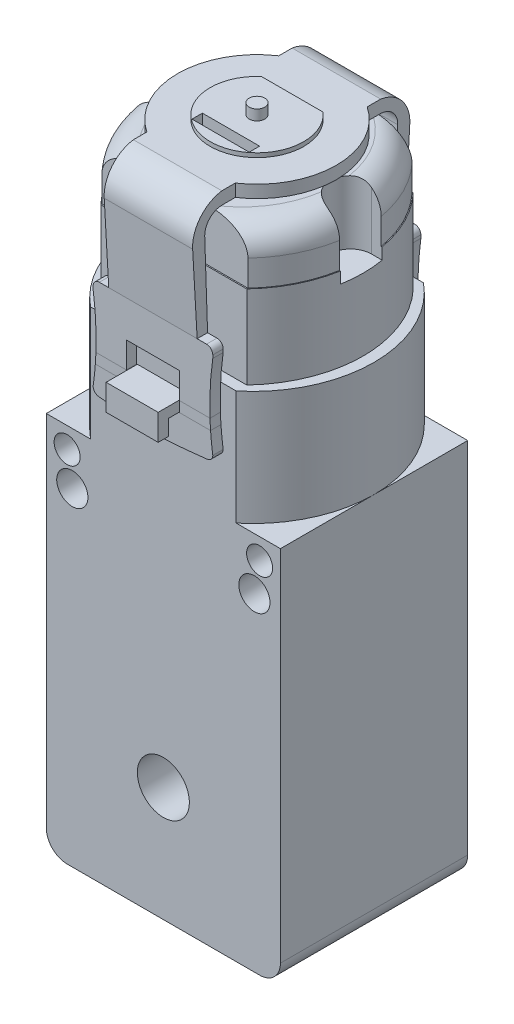
from build123d import *

# Parameters (mm, degrees)
SALIENTE_EXTRUIR1_DEPTH         = 9
SALIENTE_EXTRUIR1_DEPTH_BACK    = 9
CROQUIS1_R                      = 1.5
CROQUIS1_R_2                    = 1.25
SALIENTE_EXTRUIR2_DEPTH         = 11
SALIENTE_EXTRUIR3_DEPTH         = 1.5
SALIENTE_EXTRUIR3_DEPTH_BACK    = 1.5
CROQUIS3_W                      = 5
CROQUIS3_H                      = 5
CROQUIS3_R                      = 1.25
REDONDEO1_R                     = 0.3
CORTAR_EXTRUIR1_DEPTH           = 10
CORTAR_EXTRUIR1_DEPTH_BACK      = 10
CROQUIS4_R                      = 2.5
CROQUIS5_R                      = 0.75
CROQUIS5_R_2                    = 1
CORTAR_EXTRUIR2_DEPTH           = 1.5
CROQUIS6_R                      = 2
SALIENTE_EXTRUIR4_DEPTH         = 2
CROQUIS7_R                      = 3.5
CROQUIS7_R_2                    = 2.5
SALIENTE_EXTRUIR5_DEPTH         = 0.2
CORTAR_EXTRUIR5_DEPTH           = 10
CORTAR_EXTRUIR6_DEPTH           = 10
CORTAR_EXTRUIR6_DEPTH_BACK      = 10
CROQUIS9_W                      = 6
CROQUIS9_H                      = 3
SALIENTE_EXTRUIR6_DEPTH         = 2.5
SALIENTE_EXTRUIR7_DEPTH         = 18
SALIENTE_EXTRUIR8_DEPTH         = 5
REDONDEO2_R                     = 2.5
CROQUIS14_W                     = 5.5
CROQUIS14_H                     = 1
SALIENTE_EXTRUIR9_DEPTH         = 2
CROQUIS15_R                     = 0.75
SALIENTE_EXTRUIR10_DEPTH        = 1
CROQUIS16_R                     = 2.25
CORTAR_EXTRUIR7_DEPTH           = 2
SALIENTE_EXTRUIR11_DEPTH        = 1.8
CORTAR_EXTRUIR8_DEPTH           = 0.5
CROQUIS20_R                     = 7.630674975
CROQUIS20_R_2                   = 4.5
SALIENTE_EXTRUIR13_DEPTH        = 1.2
SALIENTE_EXTRUIR12_DEPTH        = 5.75
SALIENTE_EXTRUIR12_DEPTH_BACK   = 5.75
SALIENTE_EXTRUIR12_2_DEPTH      = 5.75
SALIENTE_EXTRUIR12_2_DEPTH_BACK = 5.75
CROQUIS19_W                     = 1
CROQUIS19_H                     = 3
SALIENTE_EXTRUIR12_3_DEPTH      = 5.75
SALIENTE_EXTRUIR12_3_DEPTH_BACK = 5.75
SALIENTE_EXTRUIR12_4_DEPTH      = 5.75
SALIENTE_EXTRUIR12_4_DEPTH_BACK = 5.75
CORTAR_EXTRUIR9_DEPTH           = 1
CORTAR_EXTRUIR9_DEPTH_BACK      = 1.8
CROQUIS23_W                     = 1.5
CROQUIS23_H                     = 11.127845587
CORTAR_EXTRUIR10_DEPTH          = 1.8
CORTAR_EXTRUIR10_DEPTH_BACK     = 1.8
CROQUIS24_W                     = 1.5
CROQUIS24_H                     = 11.127845587
CROQUIS21_W                     = 3.192032896
CROQUIS21_H                     = 1
SALIENTE_EXTRUIR17_DEPTH        = 1
SALIENTE_EXTRUIR17_2_DEPTH      = 1
CROQUIS26_W                     = 3.19
CROQUIS26_H                     = 1
SALIENTE_EXTRUIR18_DEPTH        = 1
SALIENTE_EXTRUIR18_2_DEPTH      = 1
CORTAR_EXTRUIR13_DEPTH          = 1
CORTAR_EXTRUIR14_DEPTH          = 1
CROQUIS29_W                     = 5.115934208
CROQUIS29_H                     = 2.5
CORTAR_EXTRUIR15_DEPTH          = 1
CROQUIS30_W                     = 5.12
CROQUIS30_H                     = 2.5
CORTAR_EXTRUIR16_DEPTH          = 1
CORTAR_EXTRUIR17_DEPTH          = 1
CORTAR_EXTRUIR18_DEPTH          = 1
CORTAR_EXTRUIR19_DEPTH          = 1.5
CORTAR_EXTRUIR19_DEPTH_BACK     = 0.3
CROQUIS33_W                     = 1.5
CROQUIS33_H                     = 0.569325025
SALIENTE_EXTRUIR19_DEPTH        = 1.2
REDONDEO3_R                     = 0.6
REDONDEO4_R                     = 0.6
REDONDEO5_R                     = 0.6
REDONDEO6_R                     = 0.6
CORTAR_EXTRUIR20_DEPTH          = 6.5


with BuildPart() as part:
    # Croquis1 → Saliente-Extruir1 (new, two sides: drawn at the far end of the back side and taken through both)
    # profile 1 of 2: a face of its own
    with BuildSketch(Plane.XY.offset(-SALIENTE_EXTRUIR1_DEPTH_BACK)):
        with BuildLine():
            Line((0, -19.25), (0, 17.25))
            Line((0, 17.25), (-11.25, 17.25))
            Line((-11.25, 17.25), (-11.25, -17.25))
            ThreePointArc((-11.25, -17.25), (-10.664213562, -18.664213562), (-9.25, -19.25))
            Line((-9.25, -19.25), (0, -19.25))
        make_face()
        with Locations((-8.75, 12.25)):
            Circle(CROQUIS1_R, mode=Mode.SUBTRACT)
        with Locations((-9.25, 15.25)):
            Circle(CROQUIS1_R_2, mode=Mode.SUBTRACT)
    # profile 2 of 2: a face of its own
    with BuildSketch(Plane.XY.offset(-SALIENTE_EXTRUIR1_DEPTH_BACK)):
        with BuildLine():
            Line((11.25, 17.25), (0, 17.25))
            Line((0, 17.25), (0, -19.25))
            Line((0, -19.25), (9.25, -19.25))
            ThreePointArc((9.25, -19.25), (10.664213562, -18.664213562), (11.25, -17.25))
            Line((11.25, -17.25), (11.25, 17.25))
        make_face()
        with Locations((8.75, 12.25)):
            Circle(CROQUIS1_R, mode=Mode.SUBTRACT)
        with Locations((9.25, 15.25)):
            Circle(CROQUIS1_R_2, mode=Mode.SUBTRACT)
    extrude(amount=SALIENTE_EXTRUIR1_DEPTH + SALIENTE_EXTRUIR1_DEPTH_BACK)

    # Croquis2 → Saliente-Extruir2 (add)
    with BuildSketch(Plane(origin=(0, 17.25, 0), x_dir=(1, 0, 0), z_dir=(0, 1, 0))):
        with BuildLine():
            Line((-7, 9), (7, 9))
            ThreePointArc((7, 9), (11.25, 0), (7, -9))
            Line((7, -9), (-7, -9))
            ThreePointArc((-7, -9), (-11.25, 0), (-7, 9))
        make_face()
    extrude(amount=SALIENTE_EXTRUIR2_DEPTH)

    # Croquis3 → Saliente-Extruir3 (add, two sides: drawn at the far end of the back side and taken through both)
    with BuildSketch(Plane.XY.offset(-SALIENTE_EXTRUIR3_DEPTH_BACK)):
        with Locations((0, -21.75)):
            Rectangle(CROQUIS3_W, CROQUIS3_H)
        with Locations((0, -21.75)):
            Circle(CROQUIS3_R, mode=Mode.SUBTRACT)
    extrude(amount=SALIENTE_EXTRUIR3_DEPTH + SALIENTE_EXTRUIR3_DEPTH_BACK)

    # Redondeo1
    redondeo1_edges = [part.edges().sort_by_distance(p)[0] for p in [
        (-2.5, -19.25, 0),
        (2.5, -19.25, 0),
    ]]
    fillet(redondeo1_edges, radius=REDONDEO1_R)

    # Croquis4 → Cortar-Extruir1 (cut, two sides: drawn at the far end of the back side and taken through both)
    with BuildSketch(Plane.XY.offset(-CORTAR_EXTRUIR1_DEPTH_BACK)):
        with Locations((0, -8.25)):
            Circle(CROQUIS4_R)
    extrude(amount=CORTAR_EXTRUIR1_DEPTH + CORTAR_EXTRUIR1_DEPTH_BACK, mode=Mode.SUBTRACT)

    # Croquis5 → Cortar-Extruir2 (cut)
    with BuildSketch(Plane(origin=(0, 0, -9), x_dir=(-1, 0, 0), z_dir=(0, 0, -1))):
        with Locations((9.75, -2.25)):
            Circle(CROQUIS5_R)
        with Locations((9.25, -17.25)):
            Circle(CROQUIS5_R_2)
        with Locations(Location((-9.25, -17.25, 0), (0, 0, 180))):
            Circle(CROQUIS5_R_2)
        with Locations(Location((-9.75, -2.25, 0), (0, 0, 180))):
            Circle(CROQUIS5_R)
    extrude(amount=-CORTAR_EXTRUIR2_DEPTH, mode=Mode.SUBTRACT)

    # Croquis6 → Saliente-Extruir4 (add)
    with BuildSketch(Plane(origin=(0, 0, -9), x_dir=(-1, 0, 0), z_dir=(0, 0, -1))):
        with Locations((0, 2.75)):
            Circle(CROQUIS6_R)
    extrude(amount=SALIENTE_EXTRUIR4_DEPTH)

    # Croquis7 → Saliente-Extruir5 (add)
    with BuildSketch(Plane(origin=(0, 0, -9), x_dir=(-1, 0, 0), z_dir=(0, 0, -1))):
        with Locations(Location((0, -8.25, 0), (0, 0, 180))):
            Circle(CROQUIS7_R)
        with Locations((0, -8.25)):
            Circle(CROQUIS7_R_2, mode=Mode.SUBTRACT)
    extrude(amount=SALIENTE_EXTRUIR5_DEPTH)

    # Croquis8 → Cortar-Extruir5 (cut)
    with BuildSketch(Plane(origin=(0, 28.25, 0), x_dir=(1, 0, 0), z_dir=(0, 1, 0))):
        with BuildLine():
            Line((-7.016222591, -8), (7.016222591, -8))
            ThreePointArc((7.016222591, -8), (10.197308847, 0), (7.016222591, 8))
            Line((7.016222591, 8), (-7.016222591, 8))
            ThreePointArc((-7.016222591, 8), (-10.197308847, 0), (-7.016222591, -8))
        make_face()
    extrude(amount=-CORTAR_EXTRUIR5_DEPTH, mode=Mode.SUBTRACT)

    # Croquis9 → Cortar-Extruir6 (cut, two sides: drawn at the far end of the back side and taken through both)
    with BuildSketch(Plane.XY.offset(-CORTAR_EXTRUIR6_DEPTH_BACK)):
        with Locations((0.040682318, 23.222154413)):
            Rectangle(CROQUIS9_W, CROQUIS9_H)
    extrude(amount=CORTAR_EXTRUIR6_DEPTH + CORTAR_EXTRUIR6_DEPTH_BACK, mode=Mode.SUBTRACT)

    # Croquis11 → Saliente-Extruir6 (add, symmetric)
    with BuildSketch(Plane(origin=(0, 0, 0), x_dir=(0, 0, -1), z_dir=(1, 0, 0))):
        Polygon((-9, 24.722154413), (-11, 24.722154413), (-11, 23.222154413), (-12, 23.222154413), (-12, 25.722154413), (-9, 25.722154413), align=None)
    saliente_extruir6 = extrude(amount=SALIENTE_EXTRUIR6_DEPTH, both=True)

    # Simetría1: Saliente-Extruir6 across plane
    add(saliente_extruir6.mirror(Plane.XY))

    # Croquis16 → Cortar-Extruir7 (cut)
    with BuildSketch(Plane(origin=(0, 0, -9), x_dir=(-1, 0, 0), z_dir=(0, 0, -1))):
        with Locations((5.994074793, 14.65)):
            Circle(CROQUIS16_R)
        with Locations((-5.994074793, 14.65)):
            Circle(CROQUIS16_R)
    extrude(amount=-CORTAR_EXTRUIR7_DEPTH, mode=Mode.SUBTRACT)

    # Croquis17 → Saliente-Extruir11 (add)
    with BuildSketch(Plane(origin=(0, 0, -7), x_dir=(-1, 0, 0), z_dir=(0, 0, -1))):
        with BuildLine():
            Line((5.690841964, 14.95), (5.690841964, 16.373528315))
            ThreePointArc((5.690841964, 16.373528315), (4.755478128, 15.886275981), (4.269980828, 14.95))
            Line((4.269980828, 14.95), (5.690841964, 14.95))
        make_face()
        with BuildLine():
            ThreePointArc((7.718168758, 14.95), (7.232671458, 15.886275981), (6.297307623, 16.373528315))
            Line((6.297307623, 16.373528315), (6.297307623, 14.95))
            Line((6.297307623, 14.95), (7.718168758, 14.95))
        make_face()
        with BuildLine():
            ThreePointArc((6.297307623, 12.926471685), (7.232671458, 13.413724019), (7.718168758, 14.35))
            Line((7.718168758, 14.35), (6.297307623, 14.35))
            Line((6.297307623, 14.35), (6.297307623, 12.926471685))
        make_face()
        with BuildLine():
            Line((6.297307623, 14.95), (6.297307623, 16.373528315))
            ThreePointArc((6.297307623, 16.373528315), (5.994074793, 16.4), (5.690841964, 16.373528315))
            Line((5.690841964, 16.373528315), (5.690841964, 14.95))
            Line((5.690841964, 14.95), (4.269980828, 14.95))
            ThreePointArc((4.269980828, 14.95), (4.244074793, 14.65), (4.269980828, 14.35))
            Line((4.269980828, 14.35), (5.690841964, 14.35))
            Line((5.690841964, 14.35), (5.690841964, 12.926471685))
            ThreePointArc((5.690841964, 12.926471685), (5.994074793, 12.9), (6.297307623, 12.926471685))
            Line((6.297307623, 12.926471685), (6.297307623, 14.35))
            Line((6.297307623, 14.35), (7.718168758, 14.35))
            ThreePointArc((7.718168758, 14.35), (7.737586256, 14.49944177), (7.744074793, 14.65))
            ThreePointArc((7.744074793, 14.65), (7.737586256, 14.80055823), (7.718168758, 14.95))
            Line((7.718168758, 14.95), (6.297307623, 14.95))
        make_face()
        with BuildLine():
            Line((5.690841964, 14.35), (4.269980828, 14.35))
            ThreePointArc((4.269980828, 14.35), (4.755478128, 13.413724019), (5.690841964, 12.926471685))
            Line((5.690841964, 12.926471685), (5.690841964, 14.35))
        make_face()
    saliente_extruir11 = extrude(amount=SALIENTE_EXTRUIR11_DEPTH)

    # Croquis18 → Cortar-Extruir8 (cut)
    with BuildSketch(Plane(origin=(0, 0, -8.8), x_dir=(-1, 0, 0), z_dir=(0, 0, -1))):
        with BuildLine():
            Line((6.294074793, 16.187725218), (6.294074793, 14.95))
            Line((6.294074793, 14.95), (7.531800011, 14.95))
            ThreePointArc((7.531800011, 14.95), (7.560790736, 14.65), (7.531800011, 14.35))
            Line((7.531800011, 14.35), (6.294074793, 14.35))
            Line((6.294074793, 14.35), (6.294074793, 13.112274782))
            ThreePointArc((6.294074793, 13.112274782), (5.994074793, 13.083284057), (5.694074793, 13.112274782))
            Line((5.694074793, 13.112274782), (5.694074793, 14.35))
            Line((5.694074793, 14.35), (4.456349575, 14.35))
            ThreePointArc((4.456349575, 14.35), (4.42735885, 14.65), (4.456349575, 14.95))
            Line((4.456349575, 14.95), (5.694074793, 14.95))
            Line((5.694074793, 14.95), (5.694074793, 16.187725218))
            ThreePointArc((5.694074793, 16.187725218), (5.994074793, 16.216715943), (6.294074793, 16.187725218))
        make_face()
    cortar_extruir8 = extrude(amount=-CORTAR_EXTRUIR8_DEPTH, mode=Mode.SUBTRACT)

    # Simetría4: Saliente-Extruir11 across plane
    add(saliente_extruir11.mirror(Plane(origin=(0, 0, 0), x_dir=(0, 0, 1), z_dir=(1, 0, 0))))

    # Simetría5: Cortar-Extruir8 across plane
    add(cortar_extruir8.mirror(Plane(origin=(0, 0, 0), x_dir=(0, 0, 1), z_dir=(1, 0, 0))), mode=Mode.SUBTRACT)


with BuildPart() as body_2:
    # Croquis12 → Saliente-Extruir7 (new body)
    with BuildSketch(Plane(origin=(0, 18.25, 0), x_dir=(1, 0, 0), z_dir=(0, 1, 0))):
        with BuildLine():
            Line((-7.016222591, 8), (7.016222591, 8))
            ThreePointArc((7.016222591, 8), (10.197308847, 0), (7.016222591, -8))
            Line((7.016222591, -8), (-7.016222591, -8))
            ThreePointArc((-7.016222591, -8), (-10.197308847, 0), (-7.016222591, 8))
        make_face()
    extrude(amount=SALIENTE_EXTRUIR7_DEPTH)

    # Croquis13 → Saliente-Extruir8 (add)
    with BuildSketch(Plane(origin=(0, 36.25, 0), x_dir=(1, 0, 0), z_dir=(0, 1, 0))):
        with BuildLine():
            Line((-7.016222591, 7.885925001), (7.016222591, 7.885925001))
            ThreePointArc((7.016222591, 7.885925001), (10.114736772, 0), (7.016222591, -7.885925001))
            Line((7.016222591, -7.885925001), (-7.016222591, -7.885925001))
            ThreePointArc((-7.016222591, -7.885925001), (-10.114736772, 0), (-7.016222591, 7.885925001))
        make_face()
    extrude(amount=SALIENTE_EXTRUIR8_DEPTH)

    # Redondeo2
    redondeo2_edges = [body_2.edges().sort_by_distance(p)[0] for p in [
        (-10.114736772, 41.25, 0),
        (10.114736772, 41.25, 0),
    ]]
    fillet(redondeo2_edges, radius=REDONDEO2_R)

    # Croquis35 → Cortar-Extruir20 (cut)
    with BuildSketch(Plane(origin=(0, 41.65, 0), x_dir=(1, 0, 0), z_dir=(0, 1, 0))):
        with BuildLine():
            Line((9.940784143, 2), (9.000780775, 2))
            ThreePointArc((9.000780775, 2), (7.000780775, 0), (9.000780775, -2))
            Line((9.000780775, -2), (9.940784143, -2))
            Line((9.940784143, -2), (10.024351149, -2))
            ThreePointArc((10.024351149, -2), (10.197308847, 0), (10.024351149, 2))
            Line((10.024351149, 2), (9.940784143, 2))
        make_face()
        with BuildLine():
            Line((-9.940784143, 2), (-10.024351149, 2))
            ThreePointArc((-10.024351149, 2), (-10.197308847, 0), (-10.024351149, -2))
            Line((-10.024351149, -2), (-9.940784143, -2))
            Line((-9.940784143, -2), (-9.000780775, -2))
            ThreePointArc((-9.000780775, -2), (-7.000780775, 0), (-9.000780775, 2))
            Line((-9.000780775, 2), (-9.940784143, 2))
        make_face()
    extrude(amount=-CORTAR_EXTRUIR20_DEPTH, mode=Mode.SUBTRACT)


with BuildPart() as body_3:
    # Croquis14 → Saliente-Extruir9 (new body)
    with BuildSketch(Plane(origin=(0, 41.25, 0), x_dir=(1, 0, 0), z_dir=(0, 1, 0))):
        with BuildLine():
            Line((2.964036418, 3.385925001), (-2.964036418, 3.385925001))
            ThreePointArc((-2.964036418, 3.385925001), (0, -4.5), (2.964036418, 3.385925001))
        make_face()
        with Locations((0, -2.998434188)):
            Rectangle(CROQUIS14_W, CROQUIS14_H, mode=Mode.SUBTRACT)
    extrude(amount=SALIENTE_EXTRUIR9_DEPTH)


with BuildPart() as body_4:
    # Croquis15 → Saliente-Extruir10 (new body)
    with BuildSketch(Plane(origin=(0, 43.25, 0), x_dir=(1, 0, 0), z_dir=(0, 1, 0))):
        with Locations(Location((0, 0, 0), (0, 0, 270))):
            Circle(CROQUIS15_R)
    extrude(amount=SALIENTE_EXTRUIR10_DEPTH)


with BuildPart() as body_5:
    # Croquis20 → Saliente-Extruir13 (new body)
    # profile 1 of 2: a face of its own
    with BuildSketch(Plane(origin=(0, 41.65, 0), x_dir=(1, 0, 0), z_dir=(0, 1, 0))):
        with Locations(Location((0, 0, 0), (0, 0, 270))):
            Circle(CROQUIS20_R)
        Circle(CROQUIS20_R_2, mode=Mode.SUBTRACT)
    # profile 2 of 2: a face of its own
    with BuildSketch(Plane(origin=(0, 41.65, 0), x_dir=(1, 0, 0), z_dir=(0, 1, 0))):
        with BuildLine():
            ThreePointArc((2.964036418, 3.385925001), (0, 4.5), (-2.964036418, 3.385925001))
            Line((-2.964036418, 3.385925001), (2.964036418, 3.385925001))
        make_face()
    extrude(amount=SALIENTE_EXTRUIR13_DEPTH)



with BuildPart() as body_6:
    # Croquis19 → Saliente-Extruir12 (new, two sides: drawn at the far end of the back side and taken through both)
    with BuildSketch(Plane(origin=(0, 0, 0), x_dir=(0, 0, -1), z_dir=(1, 0, 0)).offset(-SALIENTE_EXTRUIR12_DEPTH_BACK)):
        with BuildLine():
            Line((9, 25.722154413), (10, 25.722154413))
            Line((10, 25.722154413), (10, 25.854458454))
            Line((10, 25.854458454), (10, 31.722154413))
            Line((10, 31.722154413), (10.43327112, 39.387186332))
            ThreePointArc((10.43327112, 39.387186332), (9.700412751, 41.659588644), (7.630674975, 42.85))
            Line((7.630674975, 42.85), (7.630674975, 41.65))
            ThreePointArc((7.630674975, 41.65), (8.816058952, 41.114589069), (9.274066195, 39.897202769))
            Line((9.274066195, 39.897202769), (9, 31.722154413))
            Line((9, 31.722154413), (9, 25.722154413))
        make_face()
    extrude(amount=SALIENTE_EXTRUIR12_DEPTH + SALIENTE_EXTRUIR12_DEPTH_BACK)

    # Croquis24 → Cortar-Extruir10 (cut, two sides: drawn at the far end of the back side and taken through both)
    with BuildSketch(Plane.XY.offset(-10).offset(-CORTAR_EXTRUIR10_DEPTH_BACK)):
        with Locations((-5, 37.286077207)):
            Rectangle(CROQUIS24_W, CROQUIS24_H)
        with Locations((5, 37.286077207)):
            Rectangle(CROQUIS24_W, CROQUIS24_H)
    extrude(amount=CORTAR_EXTRUIR10_DEPTH + CORTAR_EXTRUIR10_DEPTH_BACK, mode=Mode.SUBTRACT)

    # Croquis30 → Cortar-Extruir16 (cut)
    with BuildSketch(Plane(origin=(0, 0, -10), x_dir=(-1, 0, 0), z_dir=(0, 0, -1))):
        with Locations((0, 26.972154413)):
            Rectangle(CROQUIS30_W, CROQUIS30_H)
    extrude(amount=-CORTAR_EXTRUIR16_DEPTH, mode=Mode.SUBTRACT)


with BuildPart() as body_7:
    # Croquis19 → Saliente-Extruir12 2 (new, two sides: drawn at the far end of the back side and taken through both)
    with BuildSketch(Plane(origin=(0, 0, 0), x_dir=(0, 0, -1), z_dir=(1, 0, 0)).offset(-SALIENTE_EXTRUIR12_2_DEPTH_BACK)):
        with Locations((9.5, 23.222154413)):
            Rectangle(CROQUIS19_W, CROQUIS19_H)
    extrude(amount=SALIENTE_EXTRUIR12_2_DEPTH + SALIENTE_EXTRUIR12_2_DEPTH_BACK)


with BuildPart() as body_8:
    # Croquis19 → Saliente-Extruir12 3 (new, two sides: drawn at the far end of the back side and taken through both)
    with BuildSketch(Plane(origin=(0, 0, 0), x_dir=(0, 0, -1), z_dir=(1, 0, 0)).offset(-SALIENTE_EXTRUIR12_3_DEPTH_BACK)):
        with Locations((-9.5, 23.222154413)):
            Rectangle(CROQUIS19_W, CROQUIS19_H)
    extrude(amount=SALIENTE_EXTRUIR12_3_DEPTH + SALIENTE_EXTRUIR12_3_DEPTH_BACK)


with BuildPart() as body_9:
    # Croquis19 → Saliente-Extruir12 4 (new, two sides: drawn at the far end of the back side and taken through both)
    with BuildSketch(Plane(origin=(0, 0, 0), x_dir=(0, 0, -1), z_dir=(1, 0, 0)).offset(-SALIENTE_EXTRUIR12_4_DEPTH_BACK)):
        with BuildLine():
            Line((-10.43327112, 39.387186332), (-10, 31.722154413))
            Line((-10, 31.722154413), (-10, 25.854458454))
            Line((-10, 25.854458454), (-10, 25.722154413))
            Line((-10, 25.722154413), (-9, 25.722154413))
            Line((-9, 25.722154413), (-9, 31.722154413))
            Line((-9, 31.722154413), (-9.274066195, 39.897202769))
            ThreePointArc((-9.274066195, 39.897202769), (-8.816058952, 41.114589069), (-7.630674975, 41.65))
            Line((-7.630674975, 41.65), (-7.630674975, 42.85))
            ThreePointArc((-7.630674975, 42.85), (-9.700412751, 41.659588644), (-10.43327112, 39.387186332))
        make_face()
    extrude(amount=SALIENTE_EXTRUIR12_4_DEPTH + SALIENTE_EXTRUIR12_4_DEPTH_BACK)

    # Croquis23 → Cortar-Extruir9 (cut, two sides: drawn at the far end of the back side and taken through both)
    with BuildSketch(Plane.XY.offset(10).offset(-CORTAR_EXTRUIR9_DEPTH_BACK)):
        with Locations((-5, 37.286077207)):
            Rectangle(CROQUIS23_W, CROQUIS23_H)
        with Locations((5, 37.286077207)):
            Rectangle(CROQUIS23_W, CROQUIS23_H)
    extrude(amount=CORTAR_EXTRUIR9_DEPTH + CORTAR_EXTRUIR9_DEPTH_BACK, mode=Mode.SUBTRACT)


with BuildPart() as body_10:
    # Croquis21 → Saliente-Extruir17 (new body)
    with BuildSketch(Plane.XY.offset(10)):
        with Locations((-4.153983552, 25.222154413)):
            Rectangle(CROQUIS21_W, CROQUIS21_H)
    extrude(amount=-SALIENTE_EXTRUIR17_DEPTH)


with BuildPart() as body_11:
    # Croquis21 → Saliente-Extruir17 2 (new body)
    with BuildSketch(Plane.XY.offset(10)):
        with Locations((4.153983552, 25.222154413)):
            Rectangle(CROQUIS21_W, CROQUIS21_H)
    extrude(amount=-SALIENTE_EXTRUIR17_2_DEPTH)


with BuildPart() as body_12:
    # Croquis26 → Saliente-Extruir18 (new body)
    with BuildSketch(Plane(origin=(0, 0, -10), x_dir=(-1, 0, 0), z_dir=(0, 0, -1))):
        with Locations((-4.155, 25.222154413)):
            Rectangle(CROQUIS26_W, CROQUIS26_H)
    extrude(amount=-SALIENTE_EXTRUIR18_DEPTH)


with BuildPart() as body_13:
    # Croquis26 → Saliente-Extruir18 2 (new body)
    with BuildSketch(Plane(origin=(0, 0, -10), x_dir=(-1, 0, 0), z_dir=(0, 0, -1))):
        with Locations((4.155, 25.222154413)):
            Rectangle(CROQUIS26_W, CROQUIS26_H)
    extrude(amount=-SALIENTE_EXTRUIR18_2_DEPTH)


with BuildPart() as cortar_extruir13_tool:
    # Croquis27 → Cortar-Extruir13 (new body)
    with BuildSketch(Plane.XY.offset(10)):
        with BuildLine():
            Line((5.75, 30.831718938), (5.75, 22.762824394))
            ThreePointArc((5.75, 22.762824394), (5.462941717, 26.797271666), (5.75, 30.831718938))
        make_face()
        with BuildLine():
            Line((-5.75, 30.831718938), (-5.75, 22.762824394))
            ThreePointArc((-5.75, 22.762824394), (-5.462941717, 26.797271666), (-5.75, 30.831718938))
        make_face()
        with BuildLine():
            Line((5.75, 22.241984356), (5.75, 21.722154413))
            Line((5.75, 21.722154413), (0, 21.722154413))
            ThreePointArc((0, 21.722154413), (2.879334366, 21.934125624), (5.75, 22.241984356))
        make_face()
    extrude(amount=-CORTAR_EXTRUIR13_DEPTH)


with BuildPart() as body_8_1:
    add(body_8.part)

    # Cortar-Extruir13: cut by cortar_extruir13_tool
    add(cortar_extruir13_tool.part, mode=Mode.SUBTRACT)

    # Croquis28 → Cortar-Extruir14 (cut)
    with BuildSketch(Plane.XY.offset(10)):
        with BuildLine():
            Line((0, 21.722154413), (-5.75, 21.722154413))
            Line((-5.75, 21.722154413), (-5.75, 22.241984356))
            ThreePointArc((-5.75, 22.241984356), (-2.879334366, 21.934125624), (0, 21.722154413))
        make_face()
    extrude(amount=-CORTAR_EXTRUIR14_DEPTH, mode=Mode.SUBTRACT)

    # Redondeo4
    # the kernel refuses this fillet: 0.6 mm, written as the material it takes off along each edge
    with BuildSketch(Plane(origin=(-5.75, 22.241984356, 11.334047189), x_dir=(0, 1, 0), z_dir=(0, 0, -1))) as redondeo4_piece_1:
        with BuildLine():
            CenterArc((0.531766603, 0.6), REDONDEO4_R, 186.723411355, 83.276588645)
            ThreePointArc((-0.064107134, 0.529754075), (-0.032461712, 0.264827647), (0, 0))
            Line((0, 0), (0.531766603, 0))
        make_face()
    extrude(amount=3.668094378, mode=Mode.SUBTRACT)
    with BuildSketch(Plane(origin=(5.75, 22.241984356, 11.334047189), x_dir=(-0.9927573761888502, -0.12013655572984355, 0), z_dir=(0, 0, -1))) as redondeo4_piece_2:
        with BuildLine():
            CenterArc((0.531769818, 0.599997151), REDONDEO4_R, 186.899983661, 83.276588645)
            Line((-0.063884608, 0.527915217), (0, 0))
            ThreePointArc((0, 0), (0.266809438, -0.000411123), (0.533618876, 0))
        make_face()
    extrude(amount=3.668094378, mode=Mode.SUBTRACT)


with BuildPart() as body_9_1:
    add(body_9.part)

    # Cortar-Extruir13: cut by cortar_extruir13_tool
    add(cortar_extruir13_tool.part, mode=Mode.SUBTRACT)

    # Croquis29 → Cortar-Extruir15 (cut)
    with BuildSketch(Plane.XY.offset(10)):
        with Locations((0, 26.972154413)):
            Rectangle(CROQUIS29_W, CROQUIS29_H)
    extrude(amount=-CORTAR_EXTRUIR15_DEPTH, mode=Mode.SUBTRACT)


with BuildPart() as body_10_1:
    add(body_10.part)

    # Cortar-Extruir13: cut by cortar_extruir13_tool
    add(cortar_extruir13_tool.part, mode=Mode.SUBTRACT)


with BuildPart() as body_11_1:
    add(body_11.part)

    # Cortar-Extruir13: cut by cortar_extruir13_tool
    add(cortar_extruir13_tool.part, mode=Mode.SUBTRACT)


with BuildPart() as cortar_extruir17_tool:
    # Croquis31 → Cortar-Extruir17 (new body)
    with BuildSketch(Plane(origin=(0, 0, -10), x_dir=(-1, 0, 0), z_dir=(0, 0, -1))):
        with BuildLine():
            Line((-5.75, 30.831718938), (-5.75, 22.762824394))
            ThreePointArc((-5.75, 22.762824394), (-5.630718695, 23.741023942), (-5.538602554, 24.722154413))
            ThreePointArc((-5.538602554, 24.722154413), (-5.504807912, 25.221816147), (-5.483231397, 25.722154413))
            ThreePointArc((-5.483231397, 25.722154413), (-5.510477673, 28.282478105), (-5.75, 30.831718938))
        make_face()
        with BuildLine():
            Line((-5.75, 22.241984356), (-5.75, 21.722154413))
            Line((-5.75, 21.722154413), (-0.040682318, 21.722154413))
            ThreePointArc((-0.040682318, 21.722154413), (-2.899592467, 21.935377064), (-5.75, 22.241984356))
        make_face()
        with BuildLine():
            Line((5.75, 30.831718938), (5.75, 22.762824394))
            ThreePointArc((5.75, 22.762824394), (5.630718695, 23.741023942), (5.538602554, 24.722154413))
            ThreePointArc((5.538602554, 24.722154413), (5.504807912, 25.221816147), (5.483231397, 25.722154413))
            ThreePointArc((5.483231397, 25.722154413), (5.510477673, 28.282478105), (5.75, 30.831718938))
        make_face()
    extrude(amount=-CORTAR_EXTRUIR17_DEPTH)


with BuildPart() as body_6_1:
    add(body_6.part)

    # Cortar-Extruir17: cut by cortar_extruir17_tool
    add(cortar_extruir17_tool.part, mode=Mode.SUBTRACT)


with BuildPart() as body_7_1:
    add(body_7.part)

    # Cortar-Extruir17: cut by cortar_extruir17_tool
    add(cortar_extruir17_tool.part, mode=Mode.SUBTRACT)

    # Croquis32 → Cortar-Extruir18 (cut)
    with BuildSketch(Plane(origin=(0, 0, -10), x_dir=(-1, 0, 0), z_dir=(0, 0, -1))):
        with BuildLine():
            Line((0, 21.722154413), (5.75, 21.722154413))
            Line((5.75, 21.722154413), (5.75, 22.241984356))
            ThreePointArc((5.75, 22.241984356), (2.879334366, 21.934125624), (0, 21.722154413))
        make_face()
    extrude(amount=-CORTAR_EXTRUIR18_DEPTH, mode=Mode.SUBTRACT)

    # Redondeo6
    # the kernel refuses this fillet: 0.6 mm, written as the material it takes off along each edge
    with BuildSketch(Plane(origin=(-5.75, 22.241984356, -11.334047189), x_dir=(0, 1, 0), z_dir=(0, 0, 1))) as redondeo6_piece_1:
        with BuildLine():
            CenterArc((0.531766603, -0.6), REDONDEO6_R, 90, 83.276588645)
            ThreePointArc((-0.064107134, -0.529754075), (-0.032461712, -0.264827647), (0, 0))
            Line((0, 0), (0.531766603, 0))
        make_face()
    extrude(amount=3.668094378, mode=Mode.SUBTRACT)
    with BuildSketch(Plane(origin=(5.75, 22.241984356, -11.333939562), x_dir=(-0.9927528227036376, -0.12017417781686725, 0), z_dir=(0, 0, 1))) as redondeo6_piece_2:
        with BuildLine():
            CenterArc((0.53174951, -0.59999722), REDONDEO6_R, 89.82559956, 83.272245461)
            Line((-0.063902183, -0.527892714), (0, 0))
            ThreePointArc((0, 0), (0.266787912, 0.000406033), (0.533575825, 0))
        make_face()
    extrude(amount=3.667879123, mode=Mode.SUBTRACT)


with BuildPart() as body_12_1:
    add(body_12.part)

    # Cortar-Extruir17: cut by cortar_extruir17_tool
    add(cortar_extruir17_tool.part, mode=Mode.SUBTRACT)


with BuildPart() as body_13_1:
    add(body_13.part)

    # Cortar-Extruir17: cut by cortar_extruir17_tool
    add(cortar_extruir17_tool.part, mode=Mode.SUBTRACT)


with BuildPart() as cortar_extruir19_tool:
    # Croquis33 → Cortar-Extruir19 (new, two sides: drawn at the far end of the back side and taken through both)
    with BuildSketch(Plane(origin=(0, 41.65, 0), x_dir=(1, 0, 0), z_dir=(0, 1, 0)).offset(-CORTAR_EXTRUIR19_DEPTH_BACK)):
        with Locations((-5, 7.915337488)):
            Rectangle(CROQUIS33_W, CROQUIS33_H)
        with Locations((5, 7.915337488)):
            Rectangle(CROQUIS33_W, CROQUIS33_H)
        with Locations((-5, -7.915337488)):
            Rectangle(CROQUIS33_W, CROQUIS33_H)
        with Locations((5, -7.915337488)):
            Rectangle(CROQUIS33_W, CROQUIS33_H)
    extrude(amount=CORTAR_EXTRUIR19_DEPTH + CORTAR_EXTRUIR19_DEPTH_BACK)


with BuildPart() as body_6_2:
    add(body_6_1.part)

    # Cortar-Extruir19: cut by cortar_extruir19_tool
    add(cortar_extruir19_tool.part, mode=Mode.SUBTRACT)


with BuildPart() as body_9_2:
    add(body_9_1.part)

    # Cortar-Extruir19: cut by cortar_extruir19_tool
    add(cortar_extruir19_tool.part, mode=Mode.SUBTRACT)


with BuildPart() as body_5_1:
    add(body_5.part)

    add(body_6_2.part)  # Saliente-Extruir19 merges body 6

    add(body_9_2.part)  # Saliente-Extruir19 merges body 9
    # Croquis34 → Saliente-Extruir19 (add)
    with BuildSketch(Plane(origin=(0, 41.65, 0), x_dir=(1, 0, 0), z_dir=(0, 1, 0))):
        with BuildLine():
            Line((0, 7.630674975), (-4.25, 7.630674975))
            Line((-4.25, 7.630674975), (-4.25, 6.337562668))
            ThreePointArc((-4.25, 6.337562668), (-2.221184337, 7.300242511), (0, 7.630674975))
        make_face()
        with BuildLine():
            Line((4.25, 7.630674975), (0, 7.630674975))
            ThreePointArc((0, 7.630674975), (2.221184337, 7.300242511), (4.25, 6.337562668))
            Line((4.25, 6.337562668), (4.25, 7.630674975))
        make_face()
        with BuildLine():
            Line((-4.25, -6.337562668), (-4.25, -7.630674975))
            Line((-4.25, -7.630674975), (0, -7.630674975))
            ThreePointArc((0, -7.630674975), (-2.221184337, -7.300242511), (-4.25, -6.337562668))
        make_face()
        with BuildLine():
            ThreePointArc((4.25, -6.337562668), (2.221184337, -7.300242511), (0, -7.630674975))
            Line((0, -7.630674975), (4.25, -7.630674975))
            Line((4.25, -7.630674975), (4.25, -6.337562668))
        make_face()
    extrude(amount=SALIENTE_EXTRUIR19_DEPTH)

    # Redondeo3
    redondeo3_edges = [body_5_1.edges().sort_by_distance(p)[0] for p in [
        (5.75, 31.722154413, 9.5),
        (-5.75, 31.722154413, 9.5),
    ]]
    fillet(redondeo3_edges, radius=REDONDEO3_R)

    # Redondeo5
    redondeo5_edges = [body_5_1.edges().sort_by_distance(p)[0] for p in [
        (-5.75, 31.722154413, -9.5),
        (5.75, 31.722154413, -9.5),
    ]]
    fillet(redondeo5_edges, radius=REDONDEO5_R)


solid = Compound([part.part, body_2.part, body_3.part, body_4.part, body_8_1.part, body_10_1.part, body_11_1.part, body_7_1.part, body_12_1.part, body_13_1.part, body_5_1.part])
